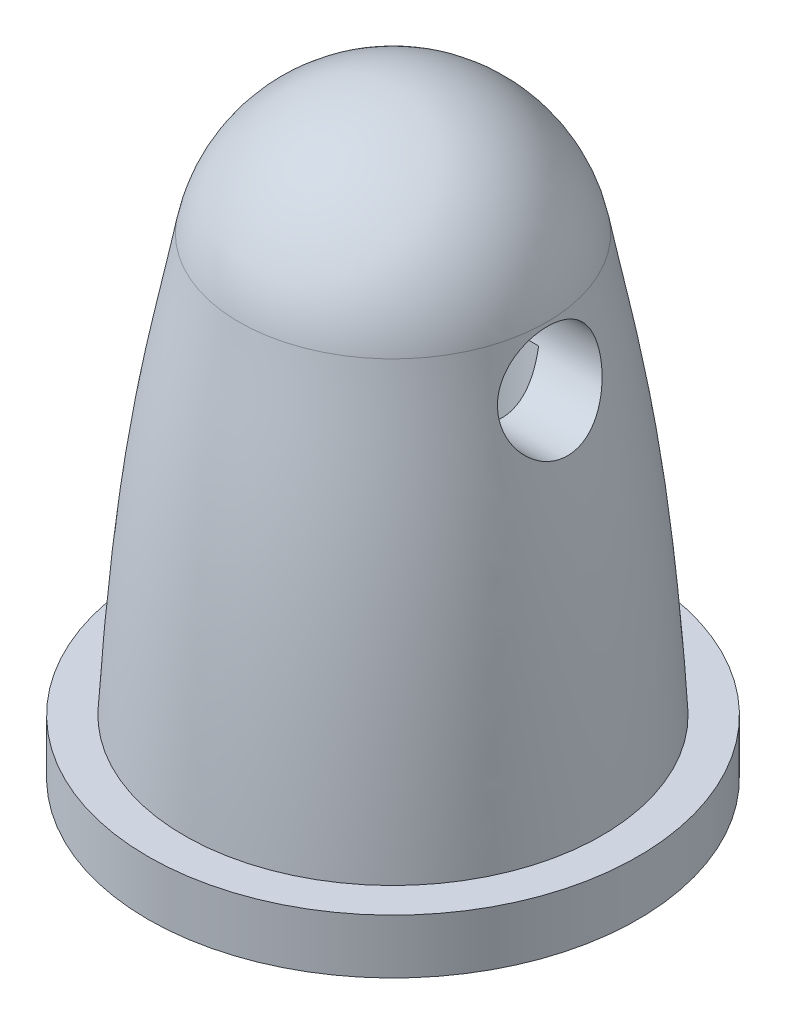
from build123d import *

# Parameters (mm, degrees)
SKETCH3_R               = 6.75
BOSS_EXTRUDE1_DEPTH     = 1.5
SKETCH5_R               = 3
CUT_EXTRUDE1_DEPTH      = 11
CUT_EXTRUDE2_DEPTH      = 18.779904387
CUT_EXTRUDE2_DEPTH_BACK = 18.779904387
SKETCH6_R               = 1.408145202


with BuildPart() as part:
    # Sketch1 → Revolve1 (revolve)
    with BuildSketch(Plane.XY):
        with BuildLine():
            Line((0, 0), (-5.75, 0))
            add(Edge.make_bspline(
                [(-5.75, 0), (-5.385455056, 6.49991136), (-4.801363332, 8.498230235), (-4.241672522, 11.5)],
                knots=[0, 0, 0, 0, 1, 1, 1, 1], degree=3))
            ThreePointArc((-4.241672522, 11.5), (-2.749626601, 14.012035059), (0, 15))
            Line((0, 15), (0, 0))
        make_face()
    revolve(axis=Axis((0, 15, 0), (0, -1, 0)))

    # Sketch3 → Boss-Extrude1 (add)
    with BuildSketch(Plane.XZ):
        Circle(SKETCH3_R)
    extrude(amount=BOSS_EXTRUDE1_DEPTH)

    # Sketch5 → Cut-Extrude1 (cut)
    with BuildSketch(Plane.XZ.offset(1.5)):
        Circle(SKETCH5_R)
    extrude(amount=-CUT_EXTRUDE1_DEPTH, mode=Mode.SUBTRACT)

    # Sketch6 → Cut-Extrude2 (cut, two sides: drawn at the far end of the back side and taken through both)
    with BuildSketch(Plane(origin=(0, 0, 0), x_dir=(0, 0, -1), z_dir=(1, 0, 0)).offset(-CUT_EXTRUDE2_DEPTH_BACK)):
        with Locations((0, 10)):
            Circle(SKETCH6_R)
    extrude(amount=CUT_EXTRUDE2_DEPTH + CUT_EXTRUDE2_DEPTH_BACK, mode=Mode.SUBTRACT)


solid = part.part
